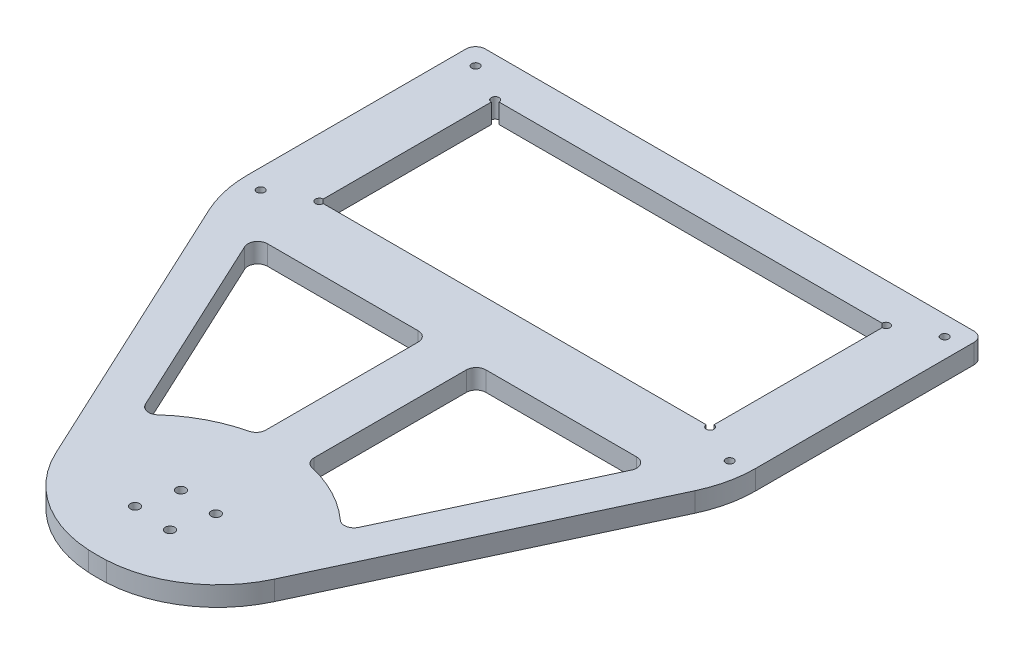
from build123d import *

# Parameters (mm, degrees)
BOSS_EXTRUDE2_DEPTH      = 6.35
CUT_EXTRUDE5_DEPTH       = 184.900225708
CUT_EXTRUDE5_DEPTH_BACK  = 184.900225708
SKETCH4_R                = 1.524
SKETCH5_R                = 1.27
CUT_EXTRUDE7_DEPTH       = 184.900225708
FILLET4_R                = 38.1
CUT_EXTRUDE9_DEPTH       = 184.900225708
CUT_EXTRUDE9_DEPTH_BACK  = 184.900225708
CUT_EXTRUDE10_DEPTH      = 184.900225708
CUT_EXTRUDE10_DEPTH_BACK = 184.900225708
FILLET5_R                = 3.175


with BuildPart() as part:
    # Sketch1 → Boss-Extrude2 (new body)
    with BuildSketch(Plane(origin=(0, 0, 0), x_dir=(1, 0, 0), z_dir=(0, 1, 0))):
        with BuildLine():
            Line((28.877480759, -156.376088954), (82.55, -41.275))
            Line((82.55, -41.275), (82.55, 41.275))
            Line((82.55, 41.275), (-82.55, 41.275))
            Line((-82.55, 41.275), (-82.55, -41.275))
            Line((-82.55, -41.275), (-28.877480759, -156.376088954))
            ThreePointArc((-28.877480759, -156.376088954), (0, -164.208611271), (28.877480759, -156.376088954))
        make_face()
    extrude(amount=BOSS_EXTRUDE2_DEPTH)

    # Sketch4 → Cut-Extrude5 (cut, two sides: drawn at the far end of the back side and taken through both)
    with BuildSketch(Plane(origin=(0, 6.35, 0), x_dir=(1, 0, 0), z_dir=(0, 1, 0)).offset(-CUT_EXTRUDE5_DEPTH_BACK)):
        with Locations((-4.702869804, -132.335666299)):
            Circle(SKETCH4_R)
        with Locations((7.603141713, -133.28460547)):
            Circle(SKETCH4_R)
        with Locations((4.702869804, -145.281556243)):
            Circle(SKETCH4_R)
        with Locations((-7.603141713, -144.332617072)):
            Circle(SKETCH4_R)
    extrude(amount=CUT_EXTRUDE5_DEPTH + CUT_EXTRUDE5_DEPTH_BACK, mode=Mode.SUBTRACT)

    # Sketch5 → Cut-Extrude7 (cut, through all)
    with BuildSketch(Plane(origin=(0, 6.35, 0), x_dir=(1, 0, 0), z_dir=(0, 1, 0))):
        with Locations((-76.2, 34.925)):
            Circle(SKETCH5_R)
        with Locations((-76.2, -34.925)):
            Circle(SKETCH5_R)
    cut_extrude7 = extrude(amount=-CUT_EXTRUDE7_DEPTH, mode=Mode.SUBTRACT)

    # Mirror2: Cut-Extrude7 across plane
    add(cut_extrude7.mirror(Plane(origin=(0, 0, 0), x_dir=(0, 0, 1), z_dir=(1, 0, 0))), mode=Mode.SUBTRACT)

    # Fillet4
    fillet4_edges = [part.edges().sort_by_distance(p)[0] for p in [
        (82.55, 3.175, 41.275),
        (28.877480759, 3.175, 156.376088954),
        (-28.877480759, 3.175, 156.376088954),
        (-82.55, 3.175, 41.275),
    ]]
    fillet(fillet4_edges, radius=FILLET4_R)

    # Sketch7 → Cut-Extrude9 (cut, two sides: drawn at the far end of the back side and taken through both)
    with BuildSketch(Plane(origin=(0, 6.35, 0), x_dir=(1, 0, 0), z_dir=(0, 1, 0)).offset(-CUT_EXTRUDE9_DEPTH_BACK)):
        with BuildLine():
            ThreePointArc((-62.23, 28.575), (-64.398025612, 29.473025612), (-63.5, 27.305))
            Line((-63.5, 27.305), (-63.5, -27.305))
            ThreePointArc((-63.5, -27.305), (-64.398025612, -29.473025612), (-62.23, -28.575))
            Line((-62.23, -28.575), (62.23, -28.575))
            ThreePointArc((62.23, -28.575), (64.398025612, -29.473025612), (63.5, -27.305))
            Line((63.5, -27.305), (63.5, 27.305))
            ThreePointArc((63.5, 27.305), (64.398025612, 29.473025612), (62.23, 28.575))
            Line((62.23, 28.575), (-62.23, 28.575))
        make_face()
    extrude(amount=CUT_EXTRUDE9_DEPTH + CUT_EXTRUDE9_DEPTH_BACK, mode=Mode.SUBTRACT)

    # Sketch8 → Cut-Extrude10 (cut, two sides: drawn at the far end of the back side and taken through both)
    with BuildSketch(Plane(origin=(0, 6.35, 0), x_dir=(1, 0, 0), z_dir=(0, 1, 0)).offset(-CUT_EXTRUDE10_DEPTH_BACK)):
        with BuildLine():
            Line((-7.817427115, -48.930189126), (-64.967427115, -48.930189126))
            Line((-64.967427115, -48.930189126), (-32.763915571, -117.990842498))
            ThreePointArc((-32.763915571, -117.990842498), (-21.432875716, -109.023683442), (-7.817427115, -104.184058961))
            Line((-7.817427115, -104.184058961), (-7.817427115, -48.930189126))
        make_face()
        with BuildLine():
            Line((64.967427115, -48.930189126), (7.817427115, -48.930189126))
            Line((7.817427115, -48.930189126), (7.817427115, -104.184058961))
            ThreePointArc((7.817427115, -104.184058961), (21.432875716, -109.023683442), (32.763915571, -117.990842498))
            Line((32.763915571, -117.990842498), (64.967427115, -48.930189126))
        make_face()
    extrude(amount=CUT_EXTRUDE10_DEPTH + CUT_EXTRUDE10_DEPTH_BACK, mode=Mode.SUBTRACT)

    # Fillet5
    fillet5_edges = [part.edges().sort_by_distance(p)[0] for p in [
        (64.967427115, 3.175, 48.930189126),
        (32.763915571, 3.175, 117.990842498),
        (7.817427115, 3.175, 104.184058961),
        (7.817427115, 3.175, 48.930189126),
        (-7.817427115, 3.175, 48.930189126),
        (-7.817427115, 3.175, 104.184058961),
        (-32.763915571, 3.175, 117.990842498),
        (-64.967427115, 3.175, 48.930189126),
        (-82.55, 3.175, -41.275),
        (82.55, 3.175, -41.275),
    ]]
    fillet(fillet5_edges, radius=FILLET5_R)


solid = part.part
